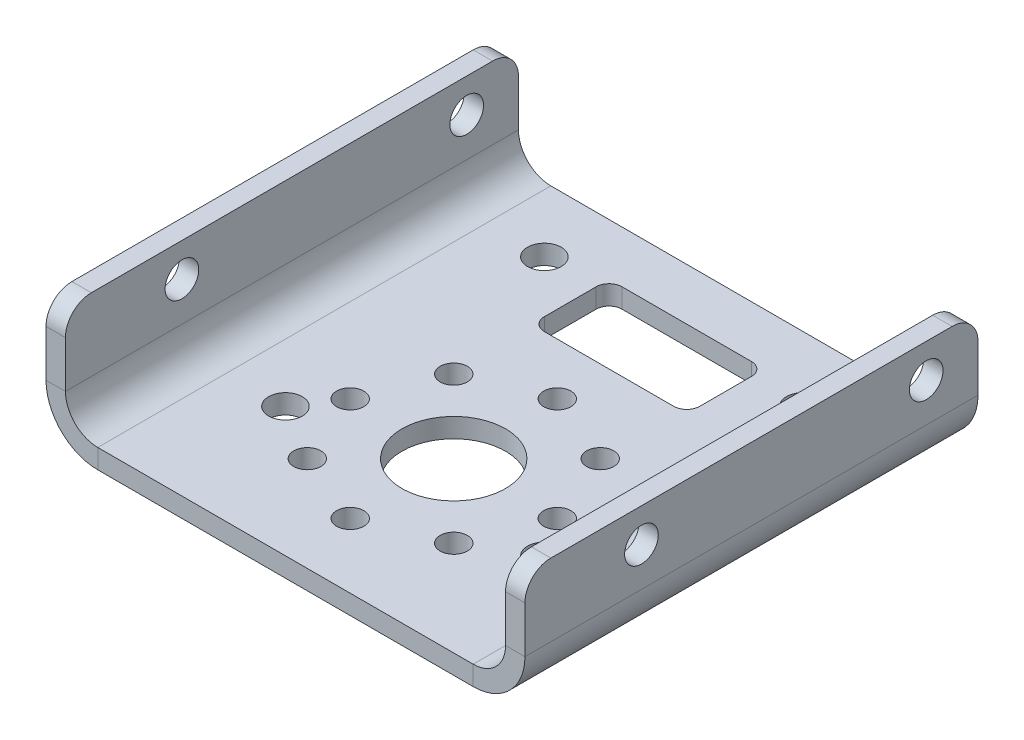
from build123d import *

# Parameters (mm, degrees)
BASE_FLANGE1_DEPTH      = 13
BASE_FLANGE1_DEPTH_BACK = 22
SKETCH5_R               = 4
SKETCH5_R_2             = 1.05
CUT_EXTRUDE1_DEPTH      = 10
CUT_EXTRUDE2_DEPTH      = 30.864025181
CUT_EXTRUDE2_DEPTH_BACK = 30.864025181
SKETCH7_R               = 1.3
FILLET1_R               = 2
SKETCH8_R               = 1.3
CUT_EXTRUDE3_DEPTH      = 10
SKETCH9_W               = 12
SKETCH9_H               = 6
CUT_EXTRUDE4_DEPTH      = 10
FILLET2_R               = 1


# Sheet-metal steps are written as plain solids
with BuildPart() as part:
    # Sketch1 → Base-Flange1 (new, two sides: drawn at the far end of the back side and taken through both)
    with BuildSketch(Plane.XY.offset(-BASE_FLANGE1_DEPTH_BACK)):
        with BuildLine():
            Line((-17, 8.1), (-17, 2.5))
            ThreePointArc((-17, 2.5), (-16.267766953, 0.732233047), (-14.5, 0))
            Line((-14.5, 0), (14.5, 0))
            ThreePointArc((14.5, 0), (16.267766953, 0.732233047), (17, 2.5))
            Line((17, 2.5), (17, 8.1))
            Line((17, 8.1), (18.5, 8.1))
            Line((18.5, 8.1), (18.5, 2.5))
            ThreePointArc((18.5, 2.5), (17.328427125, -0.328427125), (14.5, -1.5))
            Line((14.5, -1.5), (-14.5, -1.5))
            ThreePointArc((-14.5, -1.5), (-17.328427125, -0.328427125), (-18.5, 2.5))
            Line((-18.5, 2.5), (-18.5, 8.1))
            Line((-18.5, 8.1), (-17, 8.1))
        make_face()
    extrude(amount=BASE_FLANGE1_DEPTH + BASE_FLANGE1_DEPTH_BACK)

    # Sketch5 → Cut-Extrude1 (cut)
    with BuildSketch(Plane(origin=(0, 0, 0), x_dir=(1, 0, 0), z_dir=(0, 1, 0))):
        with Locations(Location((0, 0, 0), (0, 0, 180))):
            Circle(SKETCH5_R)
        with Locations(Location((0, 8, 0), (0, 0, 180))):
            Circle(SKETCH5_R_2)
        with Locations(Location((5.656854249, 5.656854249, 0), (0, 0, 180))):
            Circle(SKETCH5_R_2)
        with Locations(Location((8, 0, 0), (0, 0, 180))):
            Circle(SKETCH5_R_2)
        with Locations(Location((5.656854249, -5.656854249, 0), (0, 0, 180))):
            Circle(SKETCH5_R_2)
        with Locations(Location((0, -8, 0), (0, 0, 180))):
            Circle(SKETCH5_R_2)
        with Locations(Location((-5.656854249, -5.656854249, 0), (0, 0, 180))):
            Circle(SKETCH5_R_2)
        with Locations(Location((-8, 0, 0), (0, 0, 180))):
            Circle(SKETCH5_R_2)
        with Locations(Location((-5.656854249, 5.656854249, 0), (0, 0, 180))):
            Circle(SKETCH5_R_2)
    extrude(amount=-CUT_EXTRUDE1_DEPTH, mode=Mode.SUBTRACT)

    # Sketch7 → Cut-Extrude2 (cut, two sides: drawn at the far end of the back side and taken through both)
    with BuildSketch(Plane(origin=(0, 0, 0), x_dir=(0, 0, -1), z_dir=(1, 0, 0)).offset(-CUT_EXTRUDE2_DEPTH_BACK)):
        with Locations((-4, 5.5)):
            Circle(SKETCH7_R)
        with Locations((18, 5.5)):
            Circle(SKETCH7_R)
    extrude(amount=CUT_EXTRUDE2_DEPTH + CUT_EXTRUDE2_DEPTH_BACK, mode=Mode.SUBTRACT)

    # Fillet1
    fillet1_edges = [part.edges().sort_by_distance(p)[0] for p in [
        (-17.75, 8.1, 13),
        (-17.75, 8.1, -22),
        (17.75, 8.1, -22),
        (17.75, 8.1, 13),
    ]]
    fillet(fillet1_edges, radius=FILLET1_R)

    # Sketch8 → Cut-Extrude3 (cut)
    with BuildSketch(Plane.XZ.offset(1.5)):
        with Locations(Location((-10, 3, 0), (0, 0, 270))):
            Circle(SKETCH8_R)
        with Locations(Location((10, 3, 0), (0, 0, 270))):
            Circle(SKETCH8_R)
        with Locations(Location((10, -17, 0), (0, 0, 270))):
            Circle(SKETCH8_R)
        with Locations(Location((-10, -17, 0), (0, 0, 270))):
            Circle(SKETCH8_R)
    extrude(amount=-CUT_EXTRUDE3_DEPTH, mode=Mode.SUBTRACT)

    # Sketch9 → Cut-Extrude4 (cut)
    with BuildSketch(Plane.XZ.offset(1.5)):
        with Locations((0, -15)):
            Rectangle(SKETCH9_W, SKETCH9_H)
    extrude(amount=-CUT_EXTRUDE4_DEPTH, mode=Mode.SUBTRACT)

    # Fillet2
    fillet2_edges = [part.edges().sort_by_distance(p)[0] for p in [
        (6, -0.75, -12),
        (6, -0.75, -18),
        (-6, -0.75, -18),
        (-6, -0.75, -12),
    ]]
    fillet(fillet2_edges, radius=FILLET2_R)


solid = part.part
